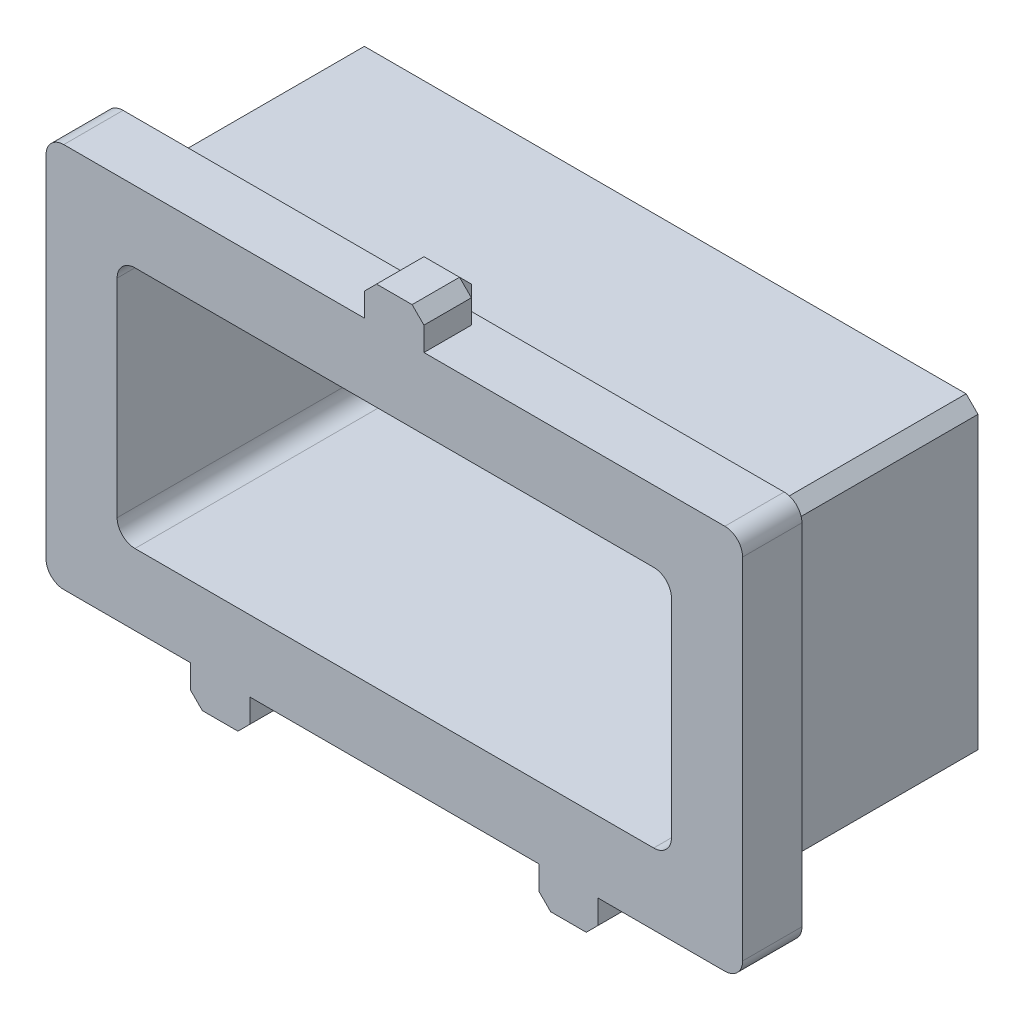
from build123d import *

# Parameters (mm, degrees)
SKETCH1_W           = 13.3985
SKETCH1_H           = 6.731
SKETCH1_W_2         = 11.8745
SKETCH1_H_2         = 5.207
EXTRUDE_THIN1_DEPTH = 5.8039
SKETCH2_W           = 14.9225
SKETCH2_H           = 8.255
SKETCH2_W_2         = 13.3985
SKETCH2_H_2         = 6.731
EXTRUDE_THIN2_DEPTH = 1.27
SKETCH4_W           = 1.27
SKETCH4_H           = 0.762
BOSS_EXTRUDE1_DEPTH = 1.27
CHAMFER1_SIZE       = 0.254
FILLET1_R           = 0.381


with BuildPart() as part:
    # Sketch1 → Extrude-Thin1 (new body)
    with BuildSketch(Plane.XY):
        with Locations((23.121102666, 199.184077883)):
            Rectangle(SKETCH1_W, SKETCH1_H)
        with Locations((23.121102666, 199.184077883)):
            Rectangle(SKETCH1_W_2, SKETCH1_H_2, mode=Mode.SUBTRACT)
    extrude(amount=EXTRUDE_THIN1_DEPTH)

    # Sketch2 → Extrude-Thin2 (add)
    with BuildSketch(Plane.XY.offset(5.8039)):
        with Locations((23.121102666, 199.184077883)):
            Rectangle(SKETCH2_W, SKETCH2_H)
        with Locations((23.121102666, 199.184077883)):
            Rectangle(SKETCH2_W_2, SKETCH2_H_2, mode=Mode.SUBTRACT)
    extrude(amount=-EXTRUDE_THIN2_DEPTH)

    # Sketch4 → Boss-Extrude1 (add)
    with BuildSketch(Plane.XY.offset(5.8039)):
        with Locations((23.121102666, 203.692577883)):
            Rectangle(SKETCH4_W, SKETCH4_H)
        with Locations((26.851727666, 194.675577883)):
            Rectangle(SKETCH4_W, SKETCH4_H)
        with Locations((19.390477666, 194.675577883)):
            Rectangle(SKETCH4_W, SKETCH4_H)
    extrude(amount=-BOSS_EXTRUDE1_DEPTH)

    # Chamfer1
    chamfer1_edges = [part.edges().sort_by_distance(p)[0] for p in [
        (29.820352666, 195.818577883, 2.26695),
        (16.421852666, 195.818577883, 2.26695),
        (29.820352666, 202.549577883, 2.26695),
        (16.421852666, 202.549577883, 2.26695),
        (27.486727666, 194.294577883, 5.1689),
        (26.216727666, 194.294577883, 5.1689),
        (20.025477666, 194.294577883, 5.1689),
        (18.755477666, 194.294577883, 5.1689),
        (23.756102666, 204.073577883, 5.1689),
        (22.486102666, 204.073577883, 5.1689),
        (26.216727666, 194.675577883, 4.5339),
        (27.486727666, 194.675577883, 4.5339),
        (26.851727666, 194.294577883, 4.5339),
        (18.755477666, 194.675577883, 4.5339),
        (19.390477666, 194.294577883, 4.5339),
        (20.025477666, 194.675577883, 4.5339),
        (23.756102666, 203.692577883, 4.5339),
        (23.121102666, 204.073577883, 4.5339),
        (22.486102666, 203.692577883, 4.5339),
    ]]
    chamfer(chamfer1_edges, length=CHAMFER1_SIZE)

    # Fillet1
    fillet1_edges = [part.edges().sort_by_distance(p)[0] for p in [
        (15.659852666, 203.311577883, 5.1689),
        (15.659852666, 195.056577883, 5.1689),
        (30.582352666, 195.056577883, 5.1689),
        (30.582352666, 203.311577883, 5.1689),
        (29.058352666, 201.787577883, 2.90195),
        (17.183852666, 201.787577883, 2.90195),
        (29.058352666, 196.580577883, 2.90195),
        (17.183852666, 196.580577883, 2.90195),
    ]]
    fillet(fillet1_edges, radius=FILLET1_R)


solid = part.part
